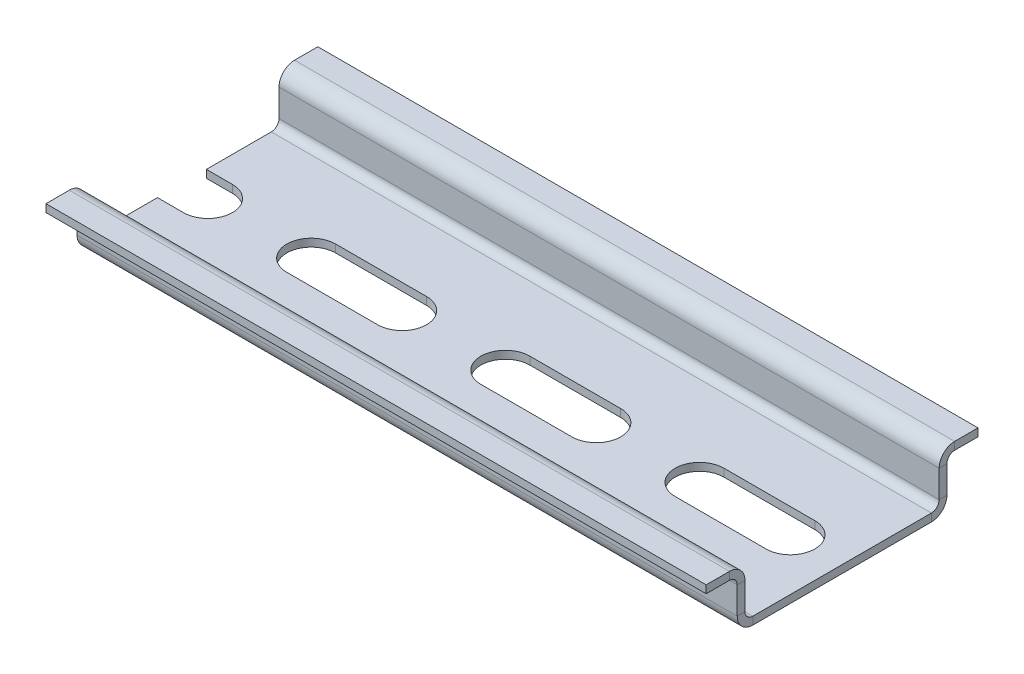
from build123d import *

# Parameters (mm, degrees)
SM_BASE_FLANGE_1_DEPTH = 100
CUT_EXTRUDE_1_DEPTH    = 102.727577382
PATTERN_LINEAR_6_COUNT = 4
PATTERN_LINEAR_6_PITCH = 25
SKETCH2_W              = 120.770502754
SKETCH2_H              = 115.80541844
CUT_EXTRUDE1_DEPTH     = 15


# Sheet-metal steps are written as plain solids
with BuildPart() as part:
    # Sketch 1 → Базовая кромка1 (new body)
    with BuildSketch(Plane(origin=(0, 0, 0), x_dir=(0, 0, -1), z_dir=(1, 0, 0))):
        with BuildLine():
            Line((-17.5, 6.5), (-14.5, 6.5))
            ThreePointArc((-14.5, 6.5), (-13.792893219, 6.207106781), (-13.5, 5.5))
            Line((-13.5, 5.5), (-13.5, 2))
            ThreePointArc((-13.5, 2), (-12.914213562, 0.585786438), (-11.5, 0))
            Line((-11.5, 0), (11.5, 0))
            ThreePointArc((11.5, 0), (12.914213562, 0.585786438), (13.5, 2))
            Line((13.5, 2), (13.5, 5.5))
            ThreePointArc((13.5, 5.5), (13.792893219, 6.207106781), (14.5, 6.5))
            Line((14.5, 6.5), (17.5, 6.5))
            Line((17.5, 6.5), (17.5, 7.5))
            Line((17.5, 7.5), (14.5, 7.5))
            ThreePointArc((14.5, 7.5), (13.085786438, 6.914213562), (12.5, 5.5))
            Line((12.5, 5.5), (12.5, 2))
            ThreePointArc((12.5, 2), (12.207106781, 1.292893219), (11.5, 1))
            Line((11.5, 1), (-11.5, 1))
            ThreePointArc((-11.5, 1), (-12.207106781, 1.292893219), (-12.5, 2))
            Line((-12.5, 2), (-12.5, 5.5))
            ThreePointArc((-12.5, 5.5), (-13.085786438, 6.914213562), (-14.5, 7.5))
            Line((-14.5, 7.5), (-17.5, 7.5))
            Line((-17.5, 7.5), (-17.5, 6.5))
        make_face()
    extrude(amount=SM_BASE_FLANGE_1_DEPTH)

    # Эскиз6 → Вырез-Вытянуть1 (cut, through all)
    with BuildSketch(Plane(origin=(0, 1, 0), x_dir=(1, 0, 0), z_dir=(0, 1, 0))):
        with BuildLine():
            Line((6.65, 3.15), (18.35, 3.15))
            ThreePointArc((18.35, 3.15), (21.5, 0), (18.35, -3.15))
            Line((18.35, -3.15), (6.65, -3.15))
            ThreePointArc((6.65, -3.15), (3.5, 0), (6.65, 3.15))
        make_face()
    cut_extrude_1 = extrude(amount=-CUT_EXTRUDE_1_DEPTH, mode=Mode.SUBTRACT)

    # Линейный массив6: Вырез-Вытянуть1 ×4
    with Locations(*[(i * PATTERN_LINEAR_6_PITCH, 0, 0) for i in range(1, PATTERN_LINEAR_6_COUNT)]):
        add(cut_extrude_1, mode=Mode.SUBTRACT)

    # Sketch2 → Cut-Extrude1 (cut)
    with BuildSketch(Plane.ZY):
        with Locations((-11.279080545, 0.592045476)):
            Rectangle(SKETCH2_W, SKETCH2_H)
    extrude(amount=-CUT_EXTRUDE1_DEPTH, mode=Mode.SUBTRACT)


solid = part.part
